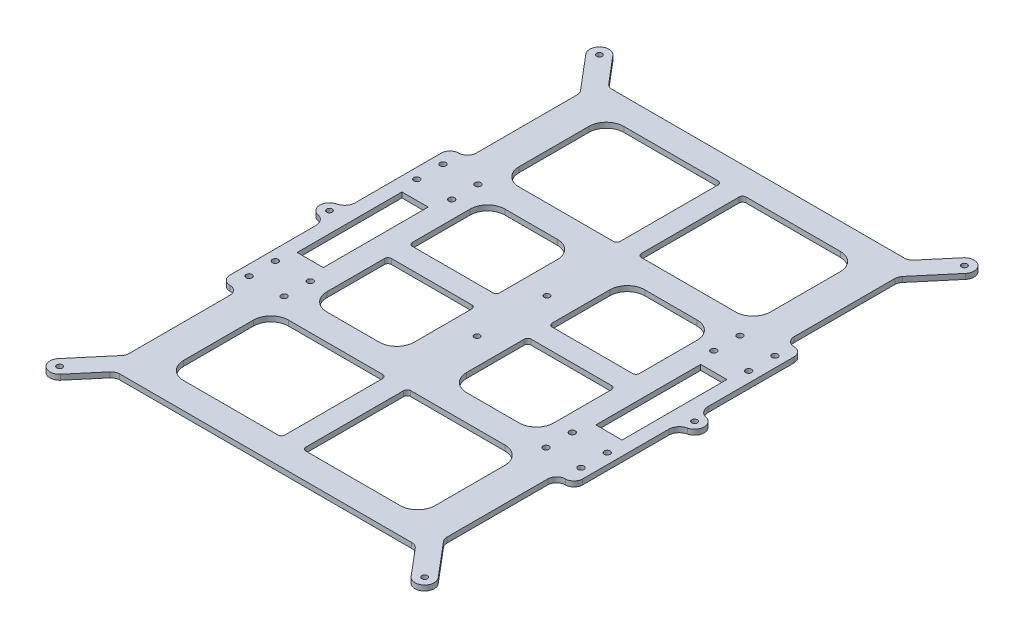
from build123d import *

# Parameters (mm, degrees)
CROQUIS1_W              = 220
CROQUIS1_H              = 320
CROQUIS1_R              = 1.7
CROQUIS1_R_2            = 1.6
SALIENTE_EXTRUIR1_DEPTH = 3
CROQUIS2_OUTSIDE_W      = 299.668
CROQUIS2_OUTSIDE_H      = 399.668
CORTAR_EXTRUIR1_DEPTH   = 3
REDONDEO1_R             = 5
CROQUIS4_W              = 15
CROQUIS4_H              = 60
CORTAR_EXTRUIR3_DEPTH   = 3


with BuildPart() as part:
    # Croquis1 → Saliente-Extruir1 (new body)
    with BuildSketch(Plane(origin=(0, 0, 0), x_dir=(1, 0, 0), z_dir=(0, 1, 0))):
        with Locations((110, 160)):
            Rectangle(CROQUIS1_W, CROQUIS1_H)
        with Locations(Location((35, 215.5, 0), (0, 0, 270))):
            Circle(CROQUIS1_R, mode=Mode.SUBTRACT)
        with Locations(Location((35, 200.5, 0), (0, 0, 270))):
            Circle(CROQUIS1_R, mode=Mode.SUBTRACT)
        with Locations(Location((35, 119.5, 0), (0, 0, 90))):
            Circle(CROQUIS1_R, mode=Mode.SUBTRACT)
        with Locations(Location((35, 104.5, 0), (0, 0, 90))):
            Circle(CROQUIS1_R, mode=Mode.SUBTRACT)
        with Locations(Location((5.5, 314.5, 0), (0, 0, 270))):
            Circle(CROQUIS1_R_2, mode=Mode.SUBTRACT)
        with Locations(Location((214.5, 314.5, 0), (0, 0, 90))):
            Circle(CROQUIS1_R_2, mode=Mode.SUBTRACT)
        with Locations(Location((214.5, 5.5, 0), (0, 0, 270))):
            Circle(CROQUIS1_R_2, mode=Mode.SUBTRACT)
        with Locations(Location((5.5, 5.5, 0), (0, 0, 90))):
            Circle(CROQUIS1_R_2, mode=Mode.SUBTRACT)
        with Locations(Location((15, 200.5, 0), (0, 0, 90))):
            Circle(CROQUIS1_R, mode=Mode.SUBTRACT)
        with Locations(Location((15, 215.5, 0), (0, 0, 90))):
            Circle(CROQUIS1_R, mode=Mode.SUBTRACT)
        with Locations(Location((15, 104.5, 0), (0, 0, 270))):
            Circle(CROQUIS1_R, mode=Mode.SUBTRACT)
        with Locations(Location((15, 119.5, 0), (0, 0, 270))):
            Circle(CROQUIS1_R, mode=Mode.SUBTRACT)
        with Locations(Location((110, 180, 0), (0, 0, 270))):
            Circle(CROQUIS1_R_2, mode=Mode.SUBTRACT)
        with Locations(Location((110, 140, 0), (0, 0, 90))):
            Circle(CROQUIS1_R_2, mode=Mode.SUBTRACT)
        with Locations(Location((5.5, 160, 0), (0, 0, 270))):
            Circle(CROQUIS1_R_2, mode=Mode.SUBTRACT)
        with Locations(Location((214.5, 160, 0), (0, 0, 90))):
            Circle(CROQUIS1_R_2, mode=Mode.SUBTRACT)
        with Locations(Location((185, 104.5, 0), (0, 0, 270))):
            Circle(CROQUIS1_R, mode=Mode.SUBTRACT)
        with Locations(Location((185, 119.5, 0), (0, 0, 270))):
            Circle(CROQUIS1_R, mode=Mode.SUBTRACT)
        with Locations(Location((205, 119.5, 0), (0, 0, 90))):
            Circle(CROQUIS1_R, mode=Mode.SUBTRACT)
        with Locations(Location((205, 104.5, 0), (0, 0, 90))):
            Circle(CROQUIS1_R, mode=Mode.SUBTRACT)
        with Locations(Location((185, 215.5, 0), (0, 0, 90))):
            Circle(CROQUIS1_R, mode=Mode.SUBTRACT)
        with Locations(Location((185, 200.5, 0), (0, 0, 90))):
            Circle(CROQUIS1_R, mode=Mode.SUBTRACT)
        with Locations(Location((205, 200.5, 0), (0, 0, 270))):
            Circle(CROQUIS1_R, mode=Mode.SUBTRACT)
        with Locations(Location((205, 215.5, 0), (0, 0, 270))):
            Circle(CROQUIS1_R, mode=Mode.SUBTRACT)
    extrude(amount=SALIENTE_EXTRUIR1_DEPTH)

    # Croquis2 outside → Cortar-Extruir1 (cut)
    # profile 1 of 9: a face of its own
    with BuildSketch(Plane(origin=(0, 3, 0), x_dir=(1, 0, 0), z_dir=(0, 1, 0))):
        with Locations((110, 160)):
            Rectangle(CROQUIS2_OUTSIDE_W, CROQUIS2_OUTSIDE_H)
        with BuildLine():
            Line((9, 148.77502784), (9, 94.5))
            Line((9, 94.5), (19, 94.5))
            Line((19, 94.5), (19, 30))
            Line((19, 30), (1.298802547, 9.049639413))
            ThreePointArc((1.298802547, 9.049639413), (1.950360587, 1.298802547), (9.701197453, 1.950360587))
            Line((9.701197453, 1.950360587), (24.106631311, 19))
            Line((24.106631311, 19), (195.893368689, 19))
            Line((195.893368689, 19), (210.298802547, 1.950360587))
            ThreePointArc((210.298802547, 1.950360587), (218.049639413, 1.298802547), (218.701197453, 9.049639413))
            Line((218.701197453, 9.049639413), (201, 30))
            Line((201, 30), (201, 94.5))
            Line((201, 94.5), (211, 94.5))
            Line((211, 94.5), (211, 148.77502784))
            ThreePointArc((211, 148.77502784), (212.318863014, 152.528287293), (215.695652174, 154.631535054))
            ThreePointArc((215.695652174, 154.631535054), (220, 160), (215.695652174, 165.368464946))
            ThreePointArc((215.695652174, 165.368464946), (212.318863014, 167.471712707), (211, 171.22497216))
            Line((211, 171.22497216), (211, 225.5))
            Line((211, 225.5), (201, 225.5))
            Line((201, 225.5), (201, 290))
            Line((201, 290), (218.701197453, 310.950360587))
            ThreePointArc((218.701197453, 310.950360587), (218.049639413, 318.701197453), (210.298802547, 318.049639413))
            Line((210.298802547, 318.049639413), (195.893368689, 301))
            Line((195.893368689, 301), (24.106631311, 301))
            Line((24.106631311, 301), (9.701197453, 318.049639413))
            ThreePointArc((9.701197453, 318.049639413), (1.950360587, 318.701197453), (1.298802547, 310.950360587))
            Line((1.298802547, 310.950360587), (19, 290))
            Line((19, 290), (19, 225.5))
            Line((19, 225.5), (9, 225.5))
            Line((9, 225.5), (9, 171.22497216))
            ThreePointArc((9, 171.22497216), (7.681136986, 167.471712707), (4.304347826, 165.368464946))
            ThreePointArc((4.304347826, 165.368464946), (0, 160), (4.304347826, 154.631535054))
            ThreePointArc((4.304347826, 154.631535054), (7.681136986, 152.528287293), (9, 148.77502784))
        make_face(mode=Mode.SUBTRACT)
    # profile 2 of 9: a face of its own
    with BuildSketch(Plane(origin=(0, 3, 0), x_dir=(1, 0, 0), z_dir=(0, 1, 0))):
        with BuildLine():
            Line((182, 276), (182, 236))
            ThreePointArc((182, 236), (179.071067812, 228.928932188), (172, 226))
            Line((172, 226), (118, 226))
            ThreePointArc((118, 226), (116.585786438, 226.585786438), (116, 228))
            Line((116, 228), (116, 284))
            ThreePointArc((116, 284), (116.585786438, 285.414213562), (118, 286))
            Line((118, 286), (172, 286))
            ThreePointArc((172, 286), (179.071067812, 283.071067812), (182, 276))
        make_face()
    # profile 3 of 9: a face of its own
    with BuildSketch(Plane(origin=(0, 3, 0), x_dir=(1, 0, 0), z_dir=(0, 1, 0))):
        with BuildLine():
            Line((102, 286), (48, 286))
            ThreePointArc((48, 286), (40.928932188, 283.071067812), (38, 276))
            Line((38, 276), (38, 236))
            ThreePointArc((38, 236), (40.928932188, 228.928932188), (48, 226))
            Line((48, 226), (102, 226))
            ThreePointArc((102, 226), (103.414213562, 226.585786438), (104, 228))
            Line((104, 228), (104, 284))
            ThreePointArc((104, 284), (103.414213562, 285.414213562), (102, 286))
        make_face()
    # profile 4 of 9: a face of its own
    with BuildSketch(Plane(origin=(0, 3, 0), x_dir=(1, 0, 0), z_dir=(0, 1, 0))):
        with BuildLine():
            Line((102, 94), (48, 94))
            ThreePointArc((48, 94), (40.928932188, 91.071067812), (38, 84))
            Line((38, 84), (38, 44))
            ThreePointArc((38, 44), (40.928932188, 36.928932188), (48, 34))
            Line((48, 34), (102, 34))
            ThreePointArc((102, 34), (103.414213562, 34.585786438), (104, 36))
            Line((104, 36), (104, 92))
            ThreePointArc((104, 92), (103.414213562, 93.414213562), (102, 94))
        make_face()
    # profile 5 of 9: a face of its own
    with BuildSketch(Plane(origin=(0, 3, 0), x_dir=(1, 0, 0), z_dir=(0, 1, 0))):
        with BuildLine():
            Line((116, 36), (116, 92))
            ThreePointArc((116, 92), (116.585786438, 93.414213562), (118, 94))
            Line((118, 94), (172, 94))
            ThreePointArc((172, 94), (179.071067812, 91.071067812), (182, 84))
            Line((182, 84), (182, 44))
            ThreePointArc((182, 44), (179.071067812, 36.928932188), (172, 34))
            Line((172, 34), (118, 34))
            ThreePointArc((118, 34), (116.585786438, 34.585786438), (116, 36))
        make_face()
    # profile 6 of 9: a face of its own
    with BuildSketch(Plane(origin=(0, 3, 0), x_dir=(1, 0, 0), z_dir=(0, 1, 0))):
        with BuildLine():
            Line((45, 152), (45, 119))
            ThreePointArc((45, 119), (47.928932188, 111.928932188), (55, 109))
            Line((55, 109), (85, 109))
            ThreePointArc((85, 109), (92.071067812, 111.928932188), (95, 119))
            Line((95, 119), (95, 152))
            ThreePointArc((95, 152), (94.414213562, 153.414213562), (93, 154))
            Line((93, 154), (47, 154))
            ThreePointArc((47, 154), (45.585786438, 153.414213562), (45, 152))
        make_face()
    # profile 7 of 9: a face of its own
    with BuildSketch(Plane(origin=(0, 3, 0), x_dir=(1, 0, 0), z_dir=(0, 1, 0))):
        with BuildLine():
            Line((93, 166), (47, 166))
            ThreePointArc((47, 166), (45.585786438, 166.585786438), (45, 168))
            Line((45, 168), (45, 201))
            ThreePointArc((45, 201), (47.928932188, 208.071067812), (55, 211))
            Line((55, 211), (85, 211))
            ThreePointArc((85, 211), (92.071067812, 208.071067812), (95, 201))
            Line((95, 201), (95, 168))
            ThreePointArc((95, 168), (94.414213562, 166.585786438), (93, 166))
        make_face()
    # profile 8 of 9: a face of its own
    with BuildSketch(Plane(origin=(0, 3, 0), x_dir=(1, 0, 0), z_dir=(0, 1, 0))):
        with BuildLine():
            Line((135, 109), (165, 109))
            ThreePointArc((165, 109), (172.071067812, 111.928932188), (175, 119))
            Line((175, 119), (175, 152))
            ThreePointArc((175, 152), (174.414213562, 153.414213562), (173, 154))
            Line((173, 154), (127, 154))
            ThreePointArc((127, 154), (125.585786438, 153.414213562), (125, 152))
            Line((125, 152), (125, 119))
            ThreePointArc((125, 119), (127.928932188, 111.928932188), (135, 109))
        make_face()
    # profile 9 of 9: a face of its own
    with BuildSketch(Plane(origin=(0, 3, 0), x_dir=(1, 0, 0), z_dir=(0, 1, 0))):
        with BuildLine():
            Line((127, 166), (173, 166))
            ThreePointArc((173, 166), (174.414213562, 166.585786438), (175, 168))
            Line((175, 168), (175, 201))
            ThreePointArc((175, 201), (172.071067812, 208.071067812), (165, 211))
            Line((165, 211), (135, 211))
            ThreePointArc((135, 211), (127.928932188, 208.071067812), (125, 201))
            Line((125, 201), (125, 168))
            ThreePointArc((125, 168), (125.585786438, 166.585786438), (127, 166))
        make_face()
    extrude(amount=-CORTAR_EXTRUIR1_DEPTH, mode=Mode.SUBTRACT)

    # Redondeo1
    redondeo1_edges = [part.edges().sort_by_distance(p)[0] for p in [
        (211, 1.5, -225.5),
        (211, 1.5, -94.5),
        (9, 1.5, -225.5),
        (9, 1.5, -94.5),
        (24.106631311, 1.5, -301),
        (195.893368689, 1.5, -301),
        (201, 1.5, -290),
        (201, 1.5, -225.5),
        (201, 1.5, -94.5),
        (201, 1.5, -30),
        (195.893368689, 1.5, -19),
        (24.106631311, 1.5, -19),
        (19, 1.5, -30),
        (19, 1.5, -94.5),
        (19, 1.5, -290),
        (19, 1.5, -225.5),
    ]]
    fillet(redondeo1_edges, radius=REDONDEO1_R - 0.0001)  # a hair under: the kernel refuses the full size

    # Croquis4 → Cortar-Extruir3 (cut)
    with BuildSketch(Plane(origin=(0, 3, 0), x_dir=(1, 0, 0), z_dir=(0, 1, 0))):
        with Locations((24.5, 160)):
            Rectangle(CROQUIS4_W, CROQUIS4_H)
        with Locations((195.5, 160)):
            Rectangle(CROQUIS4_W, CROQUIS4_H)
    extrude(amount=-CORTAR_EXTRUIR3_DEPTH, mode=Mode.SUBTRACT)


solid = part.part
